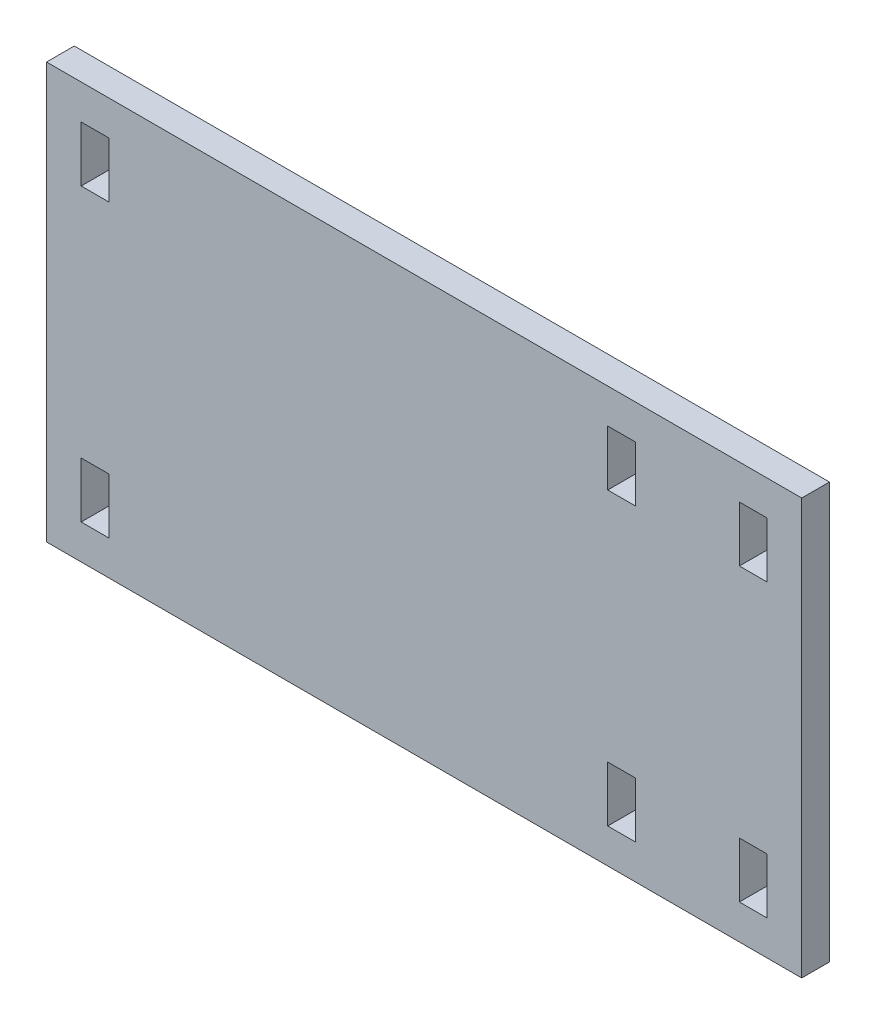
from build123d import *

# Parameters (mm, degrees)
SKETCH1_W           = 4
SKETCH1_H           = 8
BOSS_EXTRUDE1_DEPTH = 4


with BuildPart() as part:
    # Sketch1 → Boss-Extrude1 (new body)
    with BuildSketch(Plane.XY):
        Polygon((-45, -30), (55, -30), (64, -30), (64, 30), (55, 30), (-45, 30), align=None)
        with Locations((38, 21)):
            Rectangle(SKETCH1_W, SKETCH1_H, mode=Mode.SUBTRACT)
        with Locations((38, -21)):
            Rectangle(SKETCH1_W, SKETCH1_H, mode=Mode.SUBTRACT)
        with Locations((-38, 21)):
            Rectangle(SKETCH1_W, SKETCH1_H, mode=Mode.SUBTRACT)
        with Locations((-38, -21)):
            Rectangle(SKETCH1_W, SKETCH1_H, mode=Mode.SUBTRACT)
        with Locations((57, 21)):
            Rectangle(SKETCH1_W, SKETCH1_H, mode=Mode.SUBTRACT)
        with Locations((57, -21)):
            Rectangle(SKETCH1_W, SKETCH1_H, mode=Mode.SUBTRACT)
    extrude(amount=BOSS_EXTRUDE1_DEPTH)


solid = part.part
